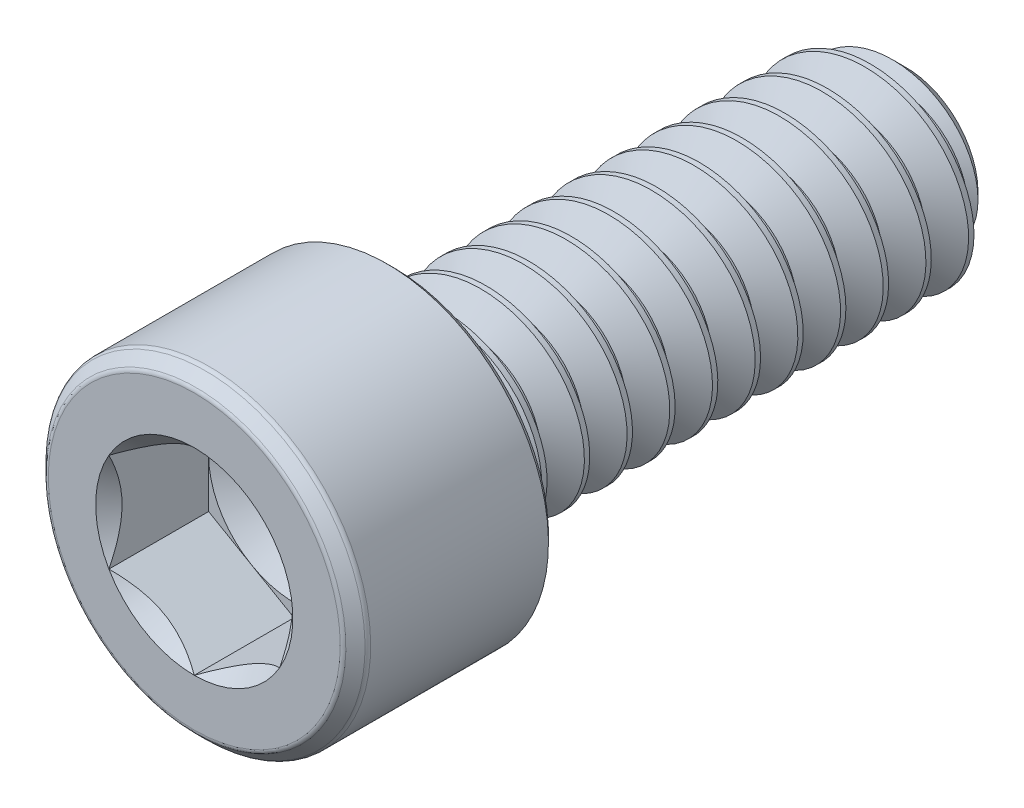
from build123d import *

# Parameters (mm, degrees)
CUT_EXTRUDE1_DEPTH = 0.9271
CUT_SWEEP1_PITCH   = 0.396875


with BuildPart() as part:
    # Sketch3 → Revolve1 (revolve)
    with BuildSketch(Plane(origin=(0, 0, 0), x_dir=(0, 0, -1), z_dir=(1, 0, 0)), mode=Mode.PRIVATE) as revolve1_sk:
        with BuildLine():
            Line((-3.30835, 1.356986084), (-3.30835, 0.79375))
            Line((-3.30835, 0.79375), (-2.38125, 0.79375))
            Line((-2.38125, 0.79375), (-2.38125, 0))
            Line((-2.38125, 0), (3.30835, 0))
            Line((3.30835, 0), (3.30835, 0.669322126))
            Line((3.30835, 0.669322126), (3.050572126, 0.9271))
            Line((3.050572126, 0.9271), (-1.3382625, 0.9271))
            ThreePointArc((-1.3382625, 0.9271), (-1.420207337, 0.961042663), (-1.45415, 1.0429875))
            Line((-1.45415, 1.0429875), (-1.45415, 1.438656))
            Line((-1.45415, 1.438656), (-1.514094, 1.4986))
            Line((-1.514094, 1.4986), (-3.166736084, 1.4986))
            ThreePointArc((-3.166736084, 1.4986), (-3.186808213, 1.494607405), (-3.203824542, 1.483237458))
            Line((-3.203824542, 1.483237458), (-3.292987458, 1.394074542))
            ThreePointArc((-3.292987458, 1.394074542), (-3.304357405, 1.377058213), (-3.30835, 1.356986084))
        make_face()
    revolve(revolve1_sk.sketch.rotate(Axis((0, 0, 3.30835), (0, 0, -1)), 180), axis=Axis((0, 0, 3.30835), (0, 0, -1)))

    # Sketch4 → Cut-Extrude1 (cut)
    with BuildSketch(Plane.XY.offset(3.30835)):
        Polygon((0, 0.916543552), (-0.79375, 0.458271776), (-0.79375, -0.458271776), (0, -0.916543552), (0.79375, -0.458271776), (0.79375, 0.458271776), align=None)
    extrude(amount=-CUT_EXTRUDE1_DEPTH, mode=Mode.SUBTRACT)

    # Cut-Extrude2 cone 1 section (through the dimple's axis) → Cut-Extrude2 (revolve, cut)
    with BuildSketch(Plane(origin=(0, 0, 3.30835), x_dir=(0, -1, 0), z_dir=(1, 0, 0))):
        Polygon((0, 0), (0.916543552, 0), (0, 0.916543552), align=None)
    revolve(axis=Axis((0, 0, 3.30835), (0, 0, -1)), mode=Mode.SUBTRACT)

    # Cut-Extrude3 cone 1 section (through the dimple's axis) → Cut-Extrude3 (revolve, cut)
    with BuildSketch(Plane(origin=(0, 0, 2.38125), x_dir=(0, -1, 0), z_dir=(1, 0, 0))):
        Polygon((0, 0), (0.79375, 0), (0, 0.458271776), align=None)
    revolve(axis=Axis((0, 0, 2.38125), (0, 0, -1)), mode=Mode.SUBTRACT)


with BuildPart() as body_2:
    # Split1: the piece on the far side of the plane
    add(part.part)
    split(bisect_by=Plane.XY.offset(1.3382625), keep=Keep.BOTTOM)

    # Cut-Sweep1: the profile of Sketch7 screwed along a right-hand helix of 13 turns, 6 arcs to a turn; built about Z, then put on its axis
    cut_sweep1_z = Axis((0, 0, 0), (0, 0, 1))
    cut_sweep1_corners = [(0.669322126, 0, -0.148828125), (0.669322126, 0, -0.1984375), (0.94858149, 0, -0.359667969), (0.94858149, 0, 0.012402344)]
    with BuildLine(mode=Mode.PRIVATE) as cut_sweep1_profile:
        Line(cut_sweep1_corners[0], cut_sweep1_corners[1])
        Line(cut_sweep1_corners[1], cut_sweep1_corners[2])
        Line(cut_sweep1_corners[2], cut_sweep1_corners[3])
        Line(cut_sweep1_corners[3], cut_sweep1_corners[0])
    cut_sweep1_cap = Face(cut_sweep1_profile.wire())
    cut_sweep1_turn_angles = [0, 30, 60, 90, 120, 150, 180, 210, 240, 270, 300, 330, 360]
    cut_sweep1_turn_weights = [1, 0.8660254037844387, 1, 0.8660254037844387, 1, 0.8660254037844387, 1, 0.8660254037844387, 1, 0.8660254037844387, 1, 0.8660254037844387, 1]
    cut_sweep1_turn_rails = [Edge.make_bspline([Vector(p[0], p[1], 0).rotate(cut_sweep1_z, cut_sweep1_turn_angles[k]) / cut_sweep1_turn_weights[k] + Vector(0, 0, p[2] + CUT_SWEEP1_PITCH * cut_sweep1_turn_angles[k] / 360) for k in range(13)], [0, 0, 0, 1, 1, 2, 2, 3, 3, 4, 4, 5, 5, 6, 6, 6], 2, cut_sweep1_turn_weights) for p in cut_sweep1_corners]
    cut_sweep1_turn_sides = [Face.make_surface_from_curves(cut_sweep1_turn_rails[p[0]], cut_sweep1_turn_rails[p[1]]) for p in [(0, 1), (1, 2), (2, 3), (3, 0)]]
    cut_sweep1 = Plane(origin=(0, 0, -3.30835), x_dir=(0, 1, 0), z_dir=(0, 0, 1)) * Solid(Shell([*[p.moved(Location((0, 0, CUT_SWEEP1_PITCH * i))) for i in range(13) for p in cut_sweep1_turn_sides], cut_sweep1_cap, cut_sweep1_cap.rotate(cut_sweep1_z, 4680).moved(Location((0, 0, CUT_SWEEP1_PITCH * 4680 / 360)))]))
    add(cut_sweep1, mode=Mode.SUBTRACT)


with BuildPart() as part_1:
    add(part.part)

    # Split1
    split(bisect_by=Plane.XY.offset(1.3382625), keep=Keep.TOP)

    add(body_2.part)  # Revolve2 merges body 2
    # Sketch11 → Revolve2 (revolve)
    with BuildSketch(Plane(origin=(0, 0, 0), x_dir=(0, 0, -1), z_dir=(1, 0, 0)), mode=Mode.PRIVATE) as revolve2_sk:
        Polygon((-1.3382625, 0.9271), (-0.4111625, 0), (-1.922978224, 0), (-1.922978224, 0.9271), align=None)
    revolve(revolve2_sk.sketch.rotate(Axis((0, 0, 3.30835), (0, 0, -1)), 90), axis=Axis((0, 0, 3.30835), (0, 0, -1)))


solid = part_1.part
